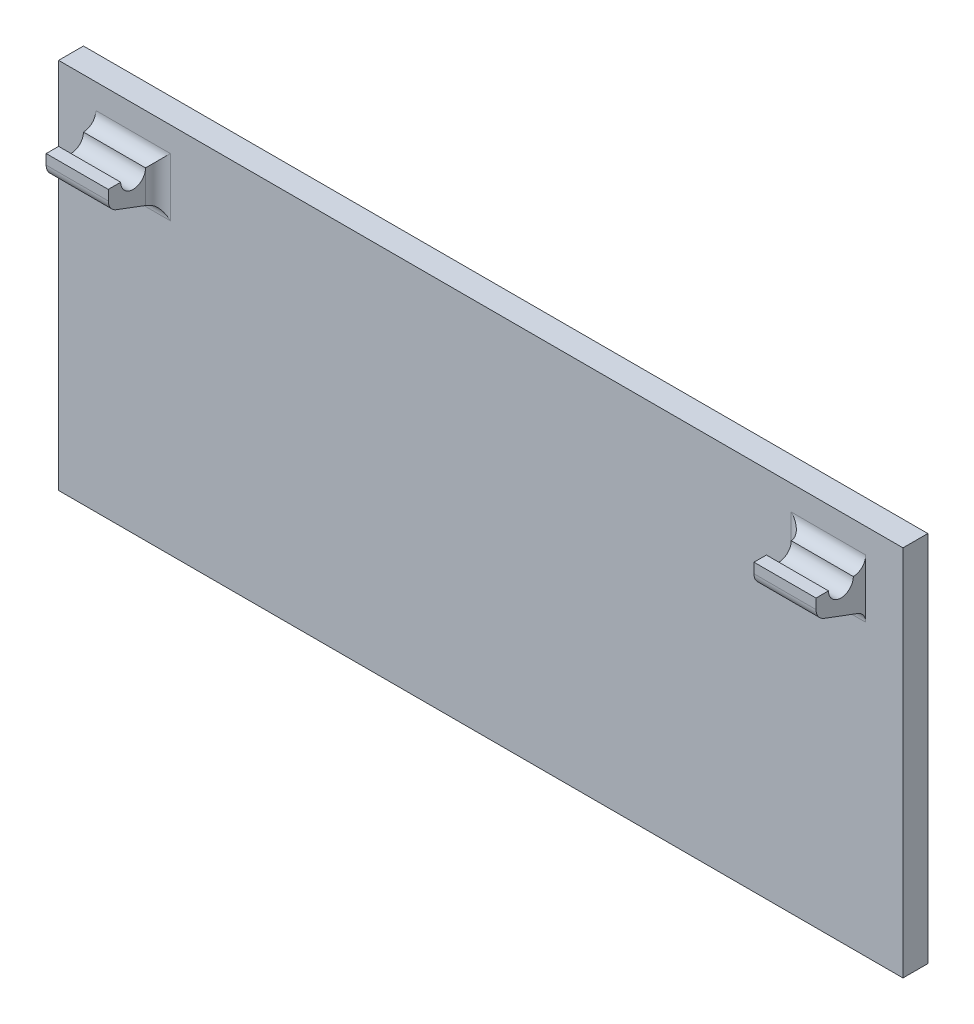
from build123d import *

# Parameters (mm, degrees)
SKETCH1_W                                     = 340
SKETCH1_H                                     = 150
VERTICAL_PORTION_DEPTH                        = 10
SHAFT_ADAPTER_RIGHT_DEPTH                     = 25
SHAFT_ADAPTER_FILLETS_R                       = 5
SKETCH5_W                                     = 100
SKETCH5_H                                     = 5
LIMIT_TAB_PREVENTS_GATE_FROM_GETTING_PU_DEPTH = 10
LIMIT_TAB_FILLETS_R                           = 5


with BuildPart() as part:
    # Sketch1 → Vertical portion (new body)
    with BuildSketch(Plane.XY):
        Rectangle(SKETCH1_W, SKETCH1_H)
    extrude(amount=VERTICAL_PORTION_DEPTH)

    # Sketch4 → Shaft adapter right (add)
    with BuildSketch(Plane(origin=(155, 0, 0), x_dir=(0, 0, -1), z_dir=(1, 0, 0))):
        with BuildLine():
            Line((-10, 45), (-30, 52.5))
            Line((-30, 52.5), (-30, 60))
            Line((-30, 60), (-25, 60))
            ThreePointArc((-25, 60), (-20, 55), (-15, 60))
            Line((-15, 60), (-10, 60))
            Line((-10, 60), (-10, 55))
            Line((-10, 55), (-10, 45))
        make_face()
    shaft_adapter_right = extrude(amount=-SHAFT_ADAPTER_RIGHT_DEPTH)

    # Shaft adapter left: Shaft adapter right across plane
    add(shaft_adapter_right.mirror(Plane(origin=(0, 0, 0), x_dir=(0, 0, 1), z_dir=(1, 0, 0))))

    # Shaft adapter fillets
    shaft_adapter_fillets_edges = [part.edges().sort_by_distance(p)[0] for p in [
        (-142.5, 52.5, 30),
        (142.5, 52.5, 30),
        (130, 52.5, 10),
        (-130, 52.5, 10),
        (-142.5, 45, 10),
        (142.5, 45, 10),
        (142.5, 60, 10),
        (-142.5, 60, 10),
    ]]
    fillet(shaft_adapter_fillets_edges, radius=SHAFT_ADAPTER_FILLETS_R - 0.0001)  # a hair under: the kernel refuses the full size

    # Sketch5 → Limit tab (prevents gate from getting pushed out of slot) (add)
    with BuildSketch(Plane(origin=(0, 0, 0), x_dir=(-1, 0, 0), z_dir=(0, 0, -1))):
        with Locations((-100, -72.5)):
            Rectangle(SKETCH5_W, SKETCH5_H)
        with Locations((100, -72.5)):
            Rectangle(SKETCH5_W, SKETCH5_H)
    extrude(amount=LIMIT_TAB_PREVENTS_GATE_FROM_GETTING_PU_DEPTH)

    # Limit tab fillets
    limit_tab_fillets_edges = [part.edges().sort_by_distance(p)[0] for p in [
        (150, -72.5, 0),
        (50, -72.5, 0),
        (100, -70, 0),
        (-150, -72.5, 0),
        (-100, -70, 0),
        (-50, -72.5, 0),
    ]]
    fillet(limit_tab_fillets_edges, radius=LIMIT_TAB_FILLETS_R)


solid = part.part
